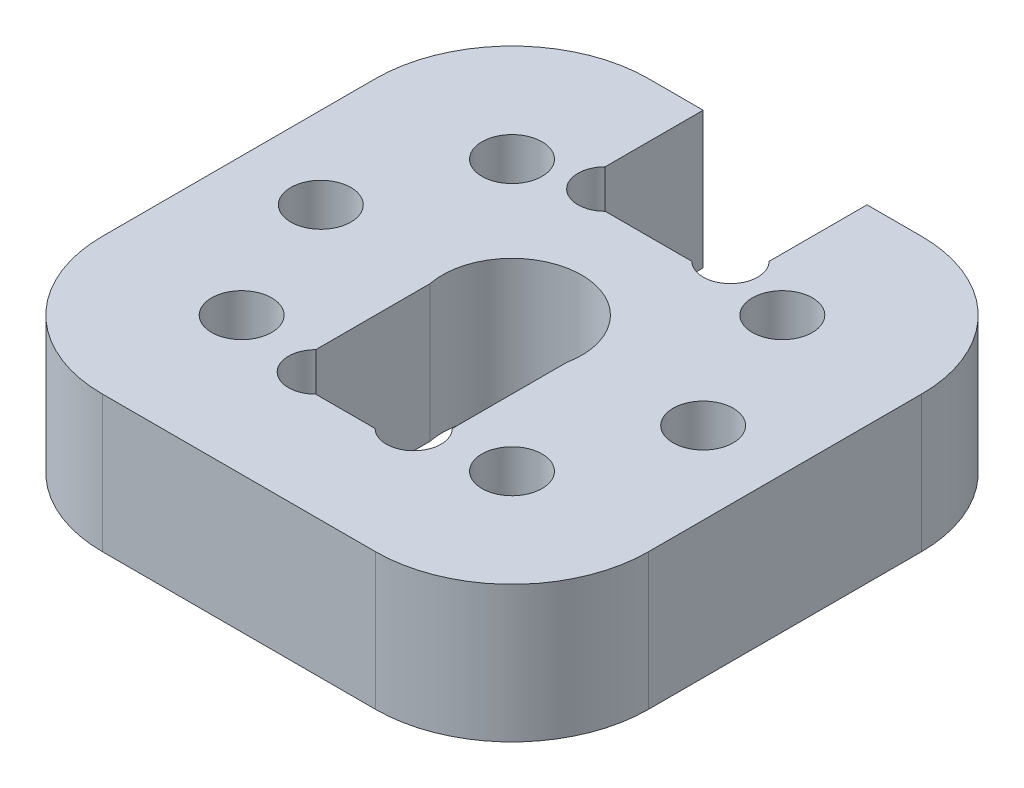
from build123d import *

# Parameters (mm, degrees)
SKETCH_1_W          = 20
SKETCH_1_H          = 20
EXTRUDE_1_DEPTH     = 5
SKETCH_2_R          = 2.55
CUT_EXTRUDE_1_DEPTH = 5
SKETCH_3_W          = 5
SKETCH_3_H          = 6.1
CUT_EXTRUDE_2_DEPTH = 5
SKETCH_5_R          = 1
CUT_EXTRUDE_4_DEPTH = 10
FILLET_1_R          = 5
SKETCH_6_W          = 6
SKETCH_6_H          = 5
CUT_EXTRUDE_5_DEPTH = 10
SKETCH_7_R          = 1
CUT_EXTRUDE_6_DEPTH = 10
SKETCH_8_R          = 1.1
CUT_EXTRUDE_7_DEPTH = 5


with BuildPart() as part:
    # 스케치1 → 보스-돌출1 (new body)
    with BuildSketch(Plane(origin=(0, 0, 0), x_dir=(1, 0, 0), z_dir=(0, 1, 0))):
        Rectangle(SKETCH_1_W, SKETCH_1_H)
    extrude(amount=EXTRUDE_1_DEPTH)

    # 스케치2 → 컷-돌출1 (cut)
    with BuildSketch(Plane(origin=(0, 5, 0), x_dir=(1, 0, 0), z_dir=(0, 1, 0))):
        Circle(SKETCH_2_R)
    extrude(amount=-CUT_EXTRUDE_1_DEPTH, mode=Mode.SUBTRACT)

    # 스케치3 → 컷-돌출2 (cut)
    with BuildSketch(Plane.XZ):
        with Locations((0, 3.05)):
            Rectangle(SKETCH_3_W, SKETCH_3_H)
    extrude(amount=-CUT_EXTRUDE_2_DEPTH, mode=Mode.SUBTRACT)

    # 스케치5 → 컷-돌출4 (cut)
    with BuildSketch(Plane(origin=(0, 0, 0), x_dir=(-1, 0, 0), z_dir=(0, -1, 0))):
        with Locations((-1.792893219, -5.392893219)):
            Circle(SKETCH_5_R)
        with Locations((1.792893219, -5.392893219)):
            Circle(SKETCH_5_R)
    extrude(amount=-CUT_EXTRUDE_4_DEPTH, mode=Mode.SUBTRACT)

    # 필렛1
    fillet_1_edges = [part.edges().sort_by_distance(p)[0] for p in [
        (10, 2.5, -10),
        (-10, 2.5, -10),
        (-10, 2.5, 10),
        (10, 2.5, 10),
    ]]
    fillet(fillet_1_edges, radius=FILLET_1_R)

    # 스케치6 → 컷-돌출5 (cut)
    with BuildSketch(Plane.XZ):
        with Locations((0, -7.5)):
            Rectangle(SKETCH_6_W, SKETCH_6_H)
    extrude(amount=-CUT_EXTRUDE_5_DEPTH, mode=Mode.SUBTRACT)

    # 스케치7 → 컷-돌출6 (cut)
    with BuildSketch(Plane(origin=(0, 0, 0), x_dir=(-1, 0, 0), z_dir=(0, -1, 0))):
        with Locations((-2.292893219, 5.707106781)):
            Circle(SKETCH_7_R)
        with Locations((2.292893219, 5.707106781)):
            Circle(SKETCH_7_R)
    extrude(amount=-CUT_EXTRUDE_6_DEPTH, mode=Mode.SUBTRACT)

    # 스케치8 → 컷-돌출7 (cut)
    with BuildSketch(Plane.XZ):
        with Locations((4.949747468, 4.949747468)):
            Circle(SKETCH_8_R)
        with Locations((7, 0)):
            Circle(SKETCH_8_R)
        with Locations((4.949747468, -4.949747468)):
            Circle(SKETCH_8_R)
        with Locations((-4.949747468, -4.949747468)):
            Circle(SKETCH_8_R)
        with Locations((-7, 0)):
            Circle(SKETCH_8_R)
        with Locations((-4.949747468, 4.949747468)):
            Circle(SKETCH_8_R)
    extrude(amount=-CUT_EXTRUDE_7_DEPTH, mode=Mode.SUBTRACT)


solid = part.part
